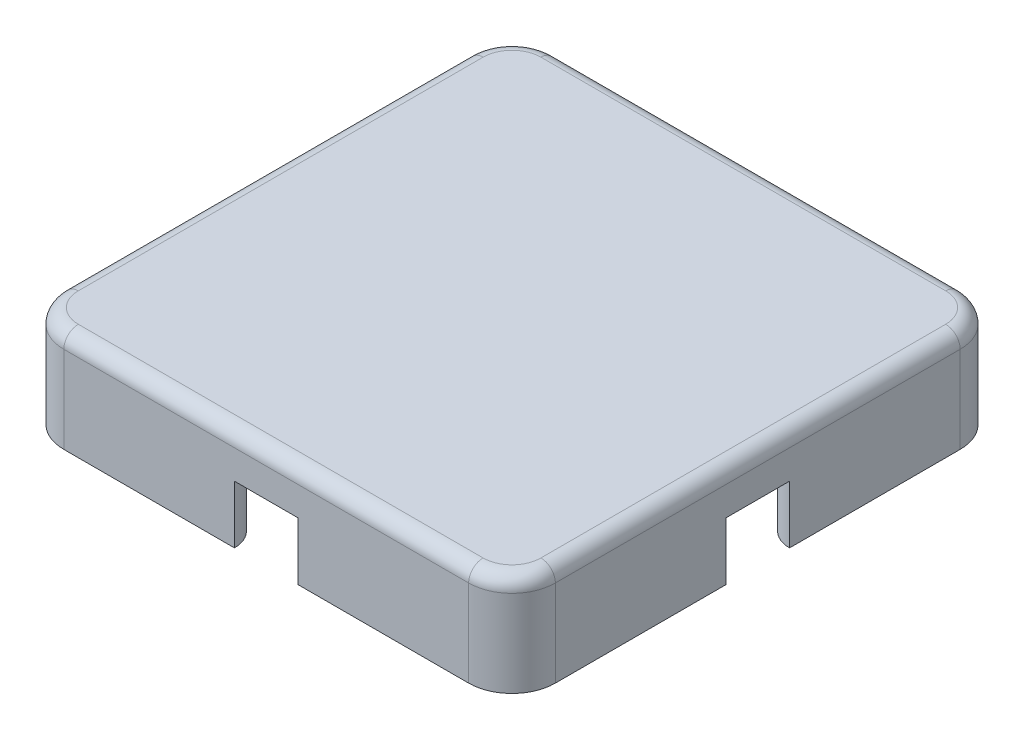
from build123d import *

# Parameters (mm, degrees)
BOSS_EXTRUDE1_DEPTH = 7
SHELL1_T            = -2
FILLET1_R           = 1
SKETCH2_R           = 8.5
BOSS_EXTRUDE2_DEPTH = 1.6
SKETCH3_W           = 4.4
SKETCH3_H           = 2
SKETCH3_W_2         = 2
SKETCH3_H_2         = 4.4
CUT_EXTRUDE1_DEPTH  = 4
FILLET2_R           = 2


with BuildPart() as part:
    # Sketch1 → Boss-Extrude1 (new body)
    with BuildSketch(Plane(origin=(0, 0, 0), x_dir=(1, 0, 0), z_dir=(0, 1, 0))):
        with BuildLine():
            Line((-14, -17), (14, -17))
            ThreePointArc((14, -17), (16.121320344, -16.121320344), (17, -14))
            Line((17, -14), (17, 14))
            ThreePointArc((17, 14), (16.121320344, 16.121320344), (14, 17))
            Line((14, 17), (-14, 17))
            ThreePointArc((-14, 17), (-16.121320344, 16.121320344), (-17, 14))
            Line((-17, 14), (-17, -14))
            ThreePointArc((-17, -14), (-16.121320344, -16.121320344), (-14, -17))
        make_face()
    extrude(amount=BOSS_EXTRUDE1_DEPTH)

    # Shell1
    shell1_openings = [part.faces().sort_by_distance(p)[0] for p in [
        (0, 0, 0),
    ]]
    offset(amount=SHELL1_T, openings=shell1_openings, kind=Kind.INTERSECTION)

    # Fillet1
    fillet1_edges = [part.edges().sort_by_distance(p)[0] for p in [
        (16.121320344, 7, 16.121320344),
        (17, 7, 0),
        (16.121320344, 7, -16.121320344),
        (0, 7, -17),
        (-16.121320344, 7, -16.121320344),
        (-17, 7, 0),
        (-16.121320344, 7, 16.121320344),
        (0, 7, 17),
    ]]
    fillet(fillet1_edges, radius=FILLET1_R)

    # Sketch2 → Boss-Extrude2 (add)
    with BuildSketch(Plane.XZ.offset(-5)):
        with Locations(Location((0, 0, 0), (0, 0, 270))):
            Circle(SKETCH2_R)
    extrude(amount=BOSS_EXTRUDE2_DEPTH)

    # Sketch3 → Cut-Extrude1 (cut)
    with BuildSketch(Plane.XZ):
        with Locations((0, 16)):
            Rectangle(SKETCH3_W, SKETCH3_H)
        with Locations((-16, 0)):
            Rectangle(SKETCH3_W_2, SKETCH3_H_2)
        with Locations((0, -16)):
            Rectangle(SKETCH3_W, SKETCH3_H)
        with Locations((16, 0)):
            Rectangle(SKETCH3_W_2, SKETCH3_H_2)
    extrude(amount=-CUT_EXTRUDE1_DEPTH, mode=Mode.SUBTRACT)

    # Fillet2
    fillet2_edges = [part.edges().sort_by_distance(p)[0] for p in [
        (-15, 2, -2.2),
        (-15, 2, 2.2),
        (-2.2, 2, 15),
        (2.2, 2, 15),
        (15, 2, 2.2),
        (15, 2, -2.2),
        (2.2, 2, -15),
        (-2.2, 2, -15),
    ]]
    fillet(fillet2_edges, radius=FILLET2_R - 0.0001)  # a hair under: the kernel refuses the full size


solid = part.part
